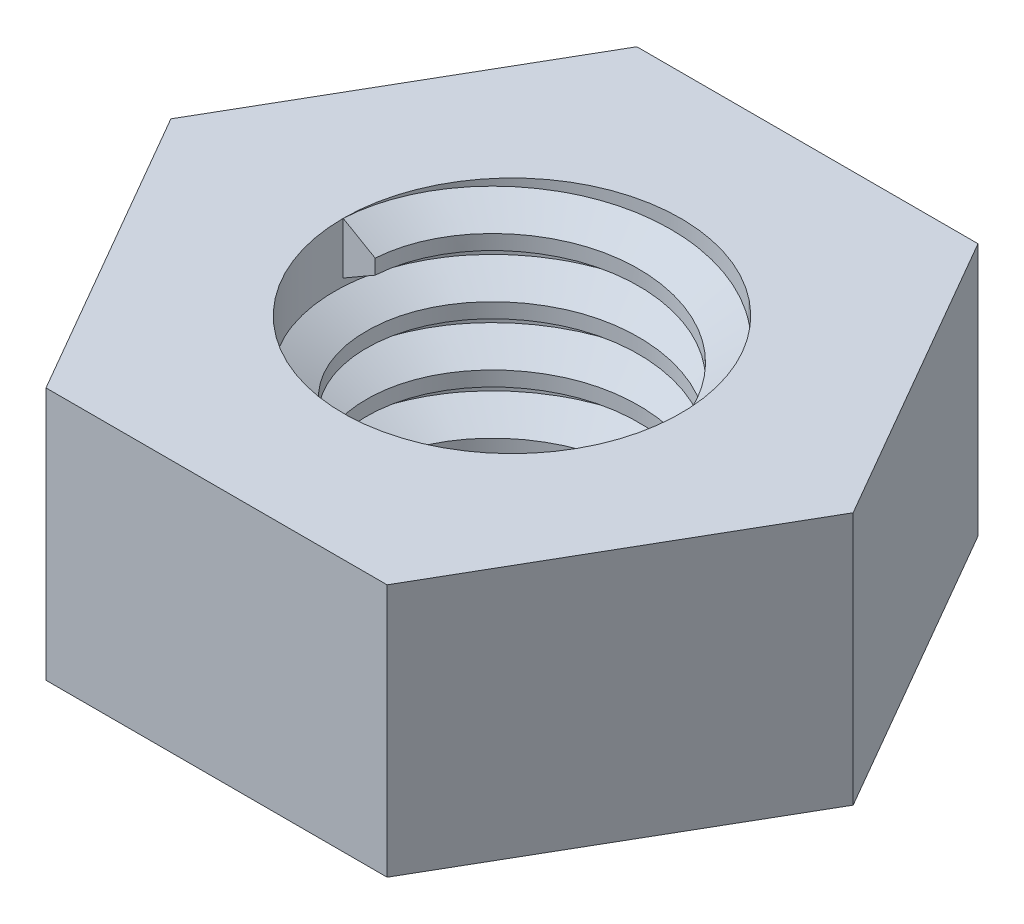
from build123d import *

# Parameters (mm, degrees)
SKETCH_1_R      = 2
EXTRUDE_1_DEPTH = 3
THREAD_1_PITCH  = 0.7


with BuildPart() as part:
    # Sketch 1 → 填料-伸長1 (new body)
    with BuildSketch(Plane(origin=(0, 0, 0), x_dir=(1, 0, 0), z_dir=(0, 1, 0))):
        Polygon((4.041451884, 0), (2.020725942, 3.5), (-2.020725942, 3.5), (-4.041451884, 0), (-2.020725942, -3.5), (2.020725942, -3.5), align=None)
        with Locations(Location((0, 0, 0), (0, 0, 270))):
            Circle(SKETCH_1_R, mode=Mode.SUBTRACT)
    extrude(amount=EXTRUDE_1_DEPTH)

    # 螺紋1: the profile of Sketch 1 2 profile screwed along a right-hand helix of 3.357143 turns, 6 arcs to a turn; built about Z, then put on its axis
    thread_1_z = Axis((0, 0, 0), (0, 0, 1))
    thread_1_corners = [(2.0003, 0, -0.000173205), (2.0003, 0, 0.612673203), (1.621113887, 0, 0.393749999), (1.621113887, 0, 0.218749999)]
    with BuildLine(mode=Mode.PRIVATE) as thread_1_profile:
        Line(thread_1_corners[0], thread_1_corners[1])
        Line(thread_1_corners[1], thread_1_corners[2])
        Line(thread_1_corners[2], thread_1_corners[3])
        Line(thread_1_corners[3], thread_1_corners[0])
    thread_1_cap = Face(thread_1_profile.wire())
    thread_1_turn_angles = [0, 30, 60, 90, 120, 150, 180, 210, 240, 270, 300, 330, 360]
    thread_1_turn_weights = [1, 0.8660254037844387, 1, 0.8660254037844387, 1, 0.8660254037844387, 1, 0.8660254037844387, 1, 0.8660254037844387, 1, 0.8660254037844387, 1]
    thread_1_turn_rails = [Edge.make_bspline([Vector(p[0], p[1], 0).rotate(thread_1_z, thread_1_turn_angles[k]) / thread_1_turn_weights[k] + Vector(0, 0, p[2] + THREAD_1_PITCH * thread_1_turn_angles[k] / 360) for k in range(13)], [0, 0, 0, 1, 1, 2, 2, 3, 3, 4, 4, 5, 5, 6, 6, 6], 2, thread_1_turn_weights) for p in thread_1_corners]
    thread_1_turn_sides = [Face.make_surface_from_curves(thread_1_turn_rails[p[0]], thread_1_turn_rails[p[1]]) for p in [(0, 1), (1, 2), (2, 3), (3, 0)]]
    thread_1_last_angles = [1080, 1110, 1140, 1170, 1200, 1204.285714286, 1208.571428571]
    thread_1_last_weights = [1, 0.8660254037844387, 1, 0.8660254037844387, 1, 0.9972037971811801, 1]
    thread_1_last_rails = [Edge.make_bspline([Vector(p[0], p[1], 0).rotate(thread_1_z, thread_1_last_angles[k]) / thread_1_last_weights[k] + Vector(0, 0, p[2] + THREAD_1_PITCH * thread_1_last_angles[k] / 360) for k in range(7)], [0, 0, 0, 1, 1, 2, 2, 3, 3, 3], 2, thread_1_last_weights) for p in thread_1_corners]
    thread_1_last_sides = [Face.make_surface_from_curves(thread_1_last_rails[p[0]], thread_1_last_rails[p[1]]) for p in [(0, 1), (1, 2), (2, 3), (3, 0)]]
    thread_1 = Plane(origin=(0, 3, 0), x_dir=(-1, 0, 0), z_dir=(0, -1, 0)) * Solid(Shell([*[p.moved(Location((0, 0, THREAD_1_PITCH * i))) for i in range(3) for p in thread_1_turn_sides], *thread_1_last_sides, thread_1_cap, thread_1_cap.rotate(thread_1_z, 1208.571428571).moved(Location((0, 0, THREAD_1_PITCH * 1208.571428571 / 360)))]))
    add(thread_1)


solid = part.part
